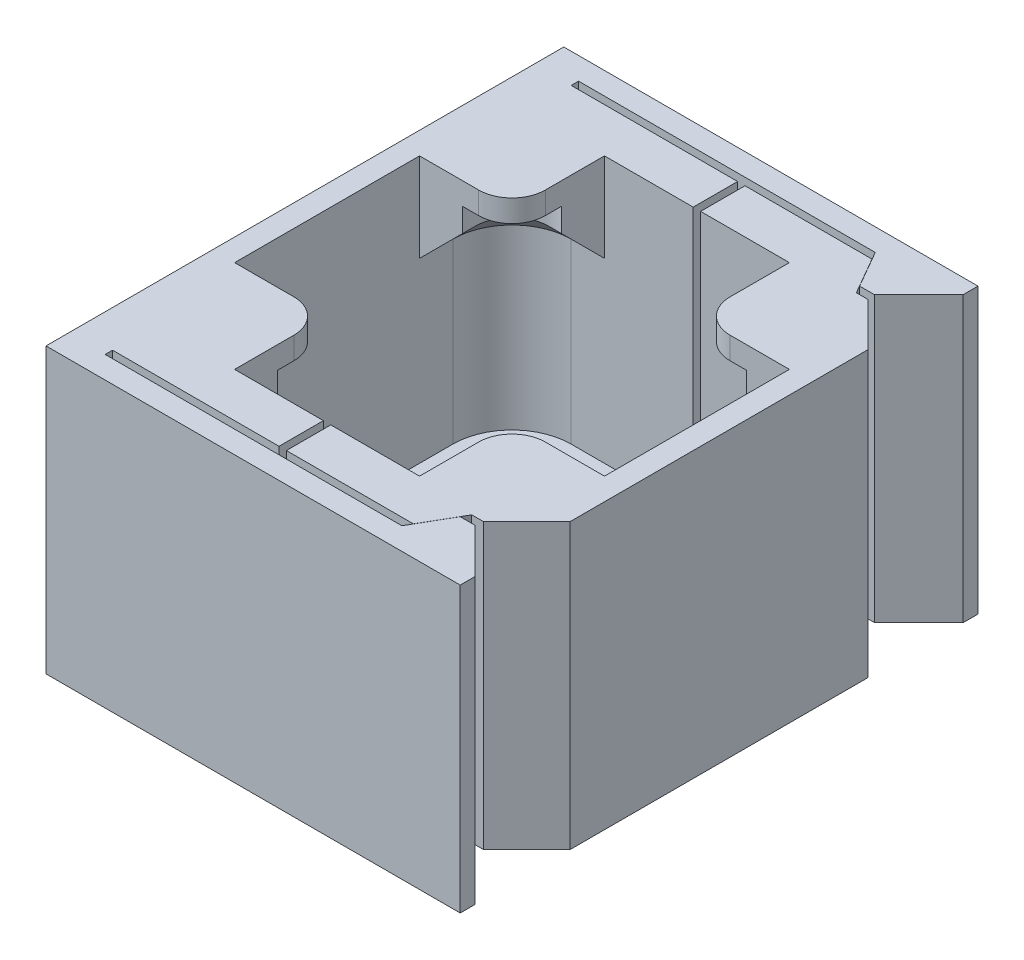
from build123d import *

# Parameters (mm, degrees)
SKETCH1_W           = 8.4
SKETCH1_H           = 3
SKETCH2_OUTSIDE_W   = 44.372
SKETCH2_OUTSIDE_H   = 44.372
SKETCH2_OUTSIDE_W_2 = 28
SKETCH2_OUTSIDE_H_2 = 35
CUT_EXTRUDE2_DEPTH  = 24.70949177
SKETCH2_3_W         = 28
SKETCH2_3_H         = 35
SKETCH2_3_W_2       = 25
SKETCH2_3_H_2       = 25
BOSS_EXTRUDE1_DEPTH = 15
BOSS_EXTRUDE2_START = -4.2
BOSS_EXTRUDE2_DEPTH = 4.2
FILLET1_R           = 4
BOSS_EXTRUDE4_DEPTH = 3
SKETCH3_5_R         = 2.25
SKETCH3_5_R_2       = 1.45
BOSS_EXTRUDE6_DEPTH = 1.5
SKETCH3_R           = 1.45
BOSS_EXTRUDE3_DEPTH = 1.5
CIRPATTERN7_COUNT   = 4
CHAMFER1_SIZE       = 3
CUT_EXTRUDE6_START  = -3
CUT_EXTRUDE6_DEPTH  = 3
CUT_EXTRUDE5_START  = -19.2
CUT_EXTRUDE5_DEPTH  = 19.2


# Read off the part's stored shape, not the designer's step: Cut-Extrude5
with BuildPart() as part:
    # Sketch1 → Revolve2 (revolve)
    with BuildSketch(Plane.XY, mode=Mode.PRIVATE) as revolve2_sk:
        with Locations((-12.3, -25.5)):
            Rectangle(SKETCH1_W, SKETCH1_H)
        Polygon((-6.35, -27), (-8.1, -27), (-16.5, -27), (-16.5, -28.2), (-8.1, -28.2), (-6.35, -28.2), align=None)
    revolve(revolve2_sk.sketch.rotate(Axis((0, 21.737527327, 0), (0, -1, 0)), 270), axis=Axis((0, 21.737527327, 0), (0, -1, 0)))

    # Sketch2 outside → Cut-Extrude2 (cut, through all)
    with BuildSketch(Plane(origin=(0, -24, 0), x_dir=(1, 0, 0), z_dir=(0, 1, 0))):
        Rectangle(SKETCH2_OUTSIDE_W, SKETCH2_OUTSIDE_H)
        Rectangle(SKETCH2_OUTSIDE_W_2, SKETCH2_OUTSIDE_H_2, mode=Mode.SUBTRACT)
    extrude(amount=-CUT_EXTRUDE2_DEPTH, mode=Mode.SUBTRACT)

    # Sketch2<3> → Boss-Extrude1 (add)
    with BuildSketch(Plane(origin=(0, -24, 0), x_dir=(1, 0, 0), z_dir=(0, 1, 0))):
        Rectangle(SKETCH2_3_W, SKETCH2_3_H)
        Rectangle(SKETCH2_3_W_2, SKETCH2_3_H_2, mode=Mode.SUBTRACT)
    extrude(amount=BOSS_EXTRUDE1_DEPTH)

    # Sketch2<4> → Boss-Extrude2 (add)
    with BuildSketch(Plane(origin=(0, -24, 0), x_dir=(1, 0, 0), z_dir=(0, 1, 0)).offset(BOSS_EXTRUDE2_START)):
        with BuildLine():
            Line((-12.5, -12.5), (-10.770329614, -12.5))
            ThreePointArc((-10.770329614, -12.5), (-11.66726189, -11.66726189), (-12.5, -10.770329614))
            Line((-12.5, -10.770329614), (-12.5, -12.5))
        make_face()
        with BuildLine():
            Line((12.5, -10.770329614), (12.5, -12.5))
            Line((12.5, -12.5), (10.770329614, -12.5))
            ThreePointArc((10.770329614, -12.5), (0, -16.5), (-10.770329614, -12.5))
            Line((-10.770329614, -12.5), (-12.5, -12.5))
            Line((-12.5, -12.5), (-12.5, -10.770329614))
            ThreePointArc((-12.5, -10.770329614), (-13.289133528, -9.7800271), (-14, -8.732124598))
            Line((-14, -8.732124598), (-14, -17.5))
            Line((-14, -17.5), (14, -17.5))
            Line((14, -17.5), (14, -8.732124598))
            ThreePointArc((14, -8.732124598), (13.289133528, -9.7800271), (12.5, -10.770329614))
        make_face()
        with BuildLine():
            Line((10.770329614, -12.5), (12.5, -12.5))
            Line((12.5, -12.5), (12.5, -10.770329614))
            ThreePointArc((12.5, -10.770329614), (11.66726189, -11.66726189), (10.770329614, -12.5))
        make_face()
        with BuildLine():
            Line((12.5, 12.5), (12.5, 10.770329614))
            ThreePointArc((12.5, 10.770329614), (13.289133528, 9.7800271), (14, 8.732124598))
            Line((14, 8.732124598), (14, 17.5))
            Line((14, 17.5), (-14, 17.5))
            Line((-14, 17.5), (-14, 8.732124598))
            ThreePointArc((-14, 8.732124598), (-13.289133528, 9.7800271), (-12.5, 10.770329614))
            Line((-12.5, 10.770329614), (-12.5, 12.5))
            Line((-12.5, 12.5), (-10.770329614, 12.5))
            ThreePointArc((-10.770329614, 12.5), (0, 16.5), (10.770329614, 12.5))
            Line((10.770329614, 12.5), (12.5, 12.5))
        make_face()
        with BuildLine():
            ThreePointArc((10.770329614, 12.5), (11.66726189, 11.66726189), (12.5, 10.770329614))
            Line((12.5, 10.770329614), (12.5, 12.5))
            Line((12.5, 12.5), (10.770329614, 12.5))
        make_face()
        with BuildLine():
            Line((-12.5, 12.5), (-12.5, 10.770329614))
            ThreePointArc((-12.5, 10.770329614), (-11.66726189, 11.66726189), (-10.770329614, 12.5))
            Line((-10.770329614, 12.5), (-12.5, 12.5))
        make_face()
    extrude(amount=BOSS_EXTRUDE2_DEPTH)

    # Fillet1
    fillet1_edges = [part.edges().sort_by_distance(p)[0] for p in [
        (-12.5, -16.5, 12.5),
        (12.5, -16.5, 12.5),
        (12.5, -16.5, -12.5),
        (-12.5, -16.5, -12.5),
    ]]
    fillet(fillet1_edges, radius=FILLET1_R)

    # Sketch3<3> → Boss-Extrude4 (add)
    with BuildSketch(Plane(origin=(0, -9, 0), x_dir=(1, 0, 0), z_dir=(0, 1, 0))):
        with BuildLine():
            Line((-12.5, 12.5), (-12.5, 8.5))
            ThreePointArc((-12.5, 8.5), (-11.328427125, 11.328427125), (-8.5, 12.5))
            Line((-8.5, 12.5), (-12.5, 12.5))
        make_face()
        with BuildLine():
            Line((-12.5, 6.25), (-9.589724736, 6.25))
            ThreePointArc((-9.589724736, 6.25), (-10.267766953, 10.267766953), (-6.25, 9.589724736))
            Line((-6.25, 9.589724736), (-6.25, 12.5))
            Line((-6.25, 12.5), (-8.5, 12.5))
            ThreePointArc((-8.5, 12.5), (-11.328427125, 11.328427125), (-12.5, 8.5))
            Line((-12.5, 8.5), (-12.5, 6.25))
        make_face()
    boss_extrude4 = extrude(amount=-BOSS_EXTRUDE4_DEPTH)

    # Sketch3<5> → Boss-Extrude6 (add)
    # profile 1 of 2: a face of its own
    with BuildSketch(Plane(origin=(0, -9, 0), x_dir=(1, 0, 0), z_dir=(0, 1, 0))):
        with BuildLine():
            Line((-9.589724736, 6.25), (-8.5, 6.25))
            ThreePointArc((-8.5, 6.25), (-10.090990258, 10.090990258), (-6.25, 8.5))
            Line((-6.25, 8.5), (-6.25, 9.589724736))
            ThreePointArc((-6.25, 9.589724736), (-10.267766953, 10.267766953), (-9.589724736, 6.25))
        make_face()
    # profile 2 of 2: a face of its own
    with BuildSketch(Plane(origin=(0, -9, 0), x_dir=(1, 0, 0), z_dir=(0, 1, 0))):
        with Locations((-8.5, 8.5)):
            Circle(SKETCH3_5_R)
        with Locations(Location((-8.5, 8.5, 0), (0, 0, 270))):
            Circle(SKETCH3_5_R_2, mode=Mode.SUBTRACT)
    boss_extrude6 = extrude(amount=-BOSS_EXTRUDE6_DEPTH)

    # Sketch3 → Boss-Extrude3 (add)
    with BuildSketch(Plane(origin=(0, -9, 0), x_dir=(1, 0, 0), z_dir=(0, 1, 0))):
        with Locations((-8.5, 8.5)):
            Circle(SKETCH3_R)
    boss_extrude3 = extrude(amount=-BOSS_EXTRUDE3_DEPTH)

    # CirPattern7: Boss-Extrude4, Boss-Extrude6, Boss-Extrude3 ×4 about axis
    cirpattern7_axis = Axis((0, 0, 0), (0, 1, 0))
    add([boss_extrude4.rotate(cirpattern7_axis, i * 360 / CIRPATTERN7_COUNT) for i in range(1, CIRPATTERN7_COUNT)])
    add([boss_extrude6.rotate(cirpattern7_axis, i * 360 / CIRPATTERN7_COUNT) for i in range(1, CIRPATTERN7_COUNT)])
    add([boss_extrude3.rotate(cirpattern7_axis, i * 360 / CIRPATTERN7_COUNT) for i in range(1, CIRPATTERN7_COUNT)])

    # Chamfer1
    # the kernel refuses this chamfer: 3 mm, written as the material it adds along each edge
    with BuildSketch(Plane(origin=(-8.5, -12, -8.5), x_dir=(0, 0, -1), z_dir=(1, 0, 0))) as chamfer1_piece_1_section:
        Polygon((4, -CHAMFER1_SIZE), (4 - CHAMFER1_SIZE, 0), (4, 0), align=None)
    chamfer1_piece_1 = revolve(axis=Axis((-8.5, -12, -8.5), (0, 1, 0)), revolution_arc=90, mode=Mode.PRIVATE)
    chamfer1_piece_1 = chamfer1_piece_1 - Plane(origin=(-8.5, -13.21364555, -8.5), x_dir=(-0.4358898943541021, 0, 0.8999999999999833), z_dir=(0, 1, 0)) * Cylinder(2.5, 16, mode=Mode.PRIVATE)
    add(chamfer1_piece_1)
    with BuildSketch(Plane(origin=(-6.25, -12, -12.5), x_dir=(0, -0.9996219169112969, -0.02749587661058621), z_dir=(-1, 0, 0))) as chamfer1_piece_2_section:
        Polygon((CHAMFER1_SIZE * 0.999621916911, CHAMFER1_SIZE * 0.0274958766106), (-CHAMFER1_SIZE * 0.0274958766106, CHAMFER1_SIZE * 0.999621916911), (0, 0), align=None)
    chamfer1_piece_2 = extrude(amount=2.25, mode=Mode.PRIVATE)
    chamfer1_piece_2 = chamfer1_piece_2 - Plane(origin=(-8.5, -13.109465827, -8.5), x_dir=(-0.4358898943541021, 0, 0.8999999999999833), z_dir=(0, 1, 0)) * Cylinder(2.5, 17, mode=Mode.PRIVATE)
    add(chamfer1_piece_2)
    with BuildSketch(Plane(origin=(-12.5, -12, -8.5), x_dir=(-0.027495876610586206, -0.9996219169112968, 0), z_dir=(0, 0, 1))) as chamfer1_piece_3_section:
        Polygon((CHAMFER1_SIZE * 0.999621916911, CHAMFER1_SIZE * 0.0274958766106), (-CHAMFER1_SIZE * 0.0274958766106, CHAMFER1_SIZE * 0.999621916911), (0, 0), align=None)
    chamfer1_piece_3 = extrude(amount=2.25, mode=Mode.PRIVATE)
    chamfer1_piece_3 = chamfer1_piece_3 - Plane(origin=(-8.5, -13.109465904, -8.5), x_dir=(-0.4358898943541021, 0, 0.8999999999999833), z_dir=(0, 1, 0)) * Cylinder(2.5, 17, mode=Mode.PRIVATE)
    add(chamfer1_piece_3)
    with BuildSketch(Plane(origin=(-8.5, -12, 8.5), x_dir=(-1, 0, 0), z_dir=(0, 0, -1))) as chamfer1_piece_4_section:
        Polygon((4, -CHAMFER1_SIZE), (4 - CHAMFER1_SIZE, 0), (4, 0), align=None)
    chamfer1_piece_4 = revolve(axis=Axis((-8.5, -12, 8.5), (0, 1, 0)), revolution_arc=90, mode=Mode.PRIVATE)
    chamfer1_piece_4 = chamfer1_piece_4 - Plane(origin=(-8.5, -13.21364555, 8.5), x_dir=(0.8999999999999833, 0, 0.4358898943541022), z_dir=(0, 1, 0)) * Cylinder(2.5, 16, mode=Mode.PRIVATE)
    add(chamfer1_piece_4)
    with BuildSketch(Plane(origin=(-12.5, -12, 6.25), x_dir=(-0.027495876610578136, -0.9996219169112969, 0), z_dir=(0, 0, 1))) as chamfer1_piece_5_section:
        Polygon((CHAMFER1_SIZE * 0.999621916911, CHAMFER1_SIZE * 0.0274958766106), (-CHAMFER1_SIZE * 0.0274958766106, CHAMFER1_SIZE * 0.999621916911), (0, 0), align=None)
    chamfer1_piece_5 = extrude(amount=2.25, mode=Mode.PRIVATE)
    chamfer1_piece_5 = chamfer1_piece_5 - Plane(origin=(-8.5, -13.109465827, 8.5), x_dir=(0.8999999999999833, 0, 0.4358898943541022), z_dir=(0, 1, 0)) * Cylinder(2.5, 17, mode=Mode.PRIVATE)
    add(chamfer1_piece_5)
    with BuildSketch(Plane(origin=(-8.5, -12, 12.5), x_dir=(0, -0.9996219169112969, 0.02749587661058621), z_dir=(1, 0, 0))) as chamfer1_piece_6_section:
        Polygon((CHAMFER1_SIZE * 0.999621916911, CHAMFER1_SIZE * 0.0274958766106), (-CHAMFER1_SIZE * 0.0274958766106, CHAMFER1_SIZE * 0.999621916911), (0, 0), align=None)
    chamfer1_piece_6 = extrude(amount=2.25, mode=Mode.PRIVATE)
    chamfer1_piece_6 = chamfer1_piece_6 - Plane(origin=(-8.5, -13.109465224, 8.5), x_dir=(0.8999999999999833, 0, 0.4358898943541022), z_dir=(0, 1, 0)) * Cylinder(2.5, 17, mode=Mode.PRIVATE)
    add(chamfer1_piece_6)
    with BuildSketch(Plane(origin=(8.5, -12, 8.5), x_dir=(0, 0, 1), z_dir=(-1, 0, 0))) as chamfer1_piece_7_section:
        Polygon((4, -CHAMFER1_SIZE), (4 - CHAMFER1_SIZE, 0), (4, 0), align=None)
    chamfer1_piece_7 = revolve(axis=Axis((8.5, -12, 8.5), (0, 1, 0)), revolution_arc=90, mode=Mode.PRIVATE)
    chamfer1_piece_7 = chamfer1_piece_7 - Plane(origin=(8.5, -13.21364555, 8.5), x_dir=(0.4358898943541022, 0, -0.8999999999999833), z_dir=(0, 1, 0)) * Cylinder(2.5, 16, mode=Mode.PRIVATE)
    add(chamfer1_piece_7)
    with BuildSketch(Plane(origin=(6.25, -12, 12.5), x_dir=(0, -0.9996219169112969, 0.02749587661057756), z_dir=(1, 0, 0))) as chamfer1_piece_8_section:
        Polygon((CHAMFER1_SIZE * 0.999621916911, CHAMFER1_SIZE * 0.0274958766106), (-CHAMFER1_SIZE * 0.0274958766106, CHAMFER1_SIZE * 0.999621916911), (0, 0), align=None)
    chamfer1_piece_8 = extrude(amount=2.25, mode=Mode.PRIVATE)
    chamfer1_piece_8 = chamfer1_piece_8 - Plane(origin=(8.5, -13.109465827, 8.5), x_dir=(0.4358898943541022, 0, -0.8999999999999833), z_dir=(0, 1, 0)) * Cylinder(2.5, 17, mode=Mode.PRIVATE)
    add(chamfer1_piece_8)
    with BuildSketch(Plane(origin=(12.5, -12, 8.5), x_dir=(0.02749587661059426, -0.9996219169112965, 0), z_dir=(0, 0, -1))) as chamfer1_piece_9_section:
        Polygon((CHAMFER1_SIZE * 0.999621916911, CHAMFER1_SIZE * 0.0274958766106), (-CHAMFER1_SIZE * 0.0274958766106, CHAMFER1_SIZE * 0.999621916911), (0, 0), align=None)
    chamfer1_piece_9 = extrude(amount=2.25, mode=Mode.PRIVATE)
    chamfer1_piece_9 = chamfer1_piece_9 - Plane(origin=(8.5, -13.109465969, 8.5), x_dir=(0.4358898943541022, 0, -0.8999999999999833), z_dir=(0, 1, 0)) * Cylinder(2.5, 17, mode=Mode.PRIVATE)
    add(chamfer1_piece_9)
    with BuildSketch(Plane(origin=(8.5, -12, -8.5), x_dir=(1, 0, 0), z_dir=(0, 0, 1))) as chamfer1_piece_10_section:
        Polygon((4, -CHAMFER1_SIZE), (4 - CHAMFER1_SIZE, 0), (4, 0), align=None)
    chamfer1_piece_10 = revolve(axis=Axis((8.5, -12, -8.5), (0, 1, 0)), revolution_arc=90, mode=Mode.PRIVATE)
    chamfer1_piece_10 = chamfer1_piece_10 - Plane(origin=(8.5, -13.21364555, -8.5), x_dir=(-0.8999999999999831, 0, -0.4358898943541023), z_dir=(0, 1, 0)) * Cylinder(2.5, 16, mode=Mode.PRIVATE)
    add(chamfer1_piece_10)
    with BuildSketch(Plane(origin=(12.5, -12, -6.25), x_dir=(0.02749587661058506, -0.9996219169112969, 0), z_dir=(0, 0, -1))) as chamfer1_piece_11_section:
        Polygon((CHAMFER1_SIZE * 0.999621916911, CHAMFER1_SIZE * 0.0274958766106), (-CHAMFER1_SIZE * 0.0274958766106, CHAMFER1_SIZE * 0.999621916911), (0, 0), align=None)
    chamfer1_piece_11 = extrude(amount=2.25, mode=Mode.PRIVATE)
    chamfer1_piece_11 = chamfer1_piece_11 - Plane(origin=(8.5, -13.109465859, -8.5), x_dir=(-0.8999999999999831, 0, -0.4358898943541023), z_dir=(0, 1, 0)) * Cylinder(2.5, 17, mode=Mode.PRIVATE)
    add(chamfer1_piece_11)
    with BuildSketch(Plane(origin=(8.5, -12, -12.5), x_dir=(0, -0.9996219169112965, -0.027495876610595413), z_dir=(-1, 0, 0))) as chamfer1_piece_12_section:
        Polygon((CHAMFER1_SIZE * 0.999621916911, CHAMFER1_SIZE * 0.0274958766106), (-CHAMFER1_SIZE * 0.0274958766106, CHAMFER1_SIZE * 0.999621916911), (0, 0), align=None)
    chamfer1_piece_12 = extrude(amount=2.25, mode=Mode.PRIVATE)
    chamfer1_piece_12 = chamfer1_piece_12 - Plane(origin=(8.5, -13.109465904, -8.5), x_dir=(-0.8999999999999831, 0, -0.4358898943541023), z_dir=(0, 1, 0)) * Cylinder(2.5, 17, mode=Mode.PRIVATE)
    add(chamfer1_piece_12)

    # Sketch5 → Cut-Extrude6 (cut)
    with BuildSketch(Plane(origin=(0, -24, 0), x_dir=(1, 0, 0), z_dir=(0, 1, 0)).offset(CUT_EXTRUDE6_START)):
        with BuildLine():
            Line((8.5, 12.5), (-8.5, 12.5))
            ThreePointArc((-8.5, 12.5), (-11.328427125, 11.328427125), (-12.5, 8.5))
            Line((-12.5, 8.5), (-12.5, -8.5))
            ThreePointArc((-12.5, -8.5), (-11.328427125, -11.328427125), (-8.5, -12.5))
            Line((-8.5, -12.5), (8.5, -12.5))
            ThreePointArc((8.5, -12.5), (11.328427125, -11.328427125), (12.5, -8.5))
            Line((12.5, -8.5), (12.5, 8.5))
            ThreePointArc((12.5, 8.5), (11.328427125, 11.328427125), (8.5, 12.5))
        make_face()
    extrude(amount=CUT_EXTRUDE6_DEPTH, mode=Mode.SUBTRACT)

    # Cut-Extrude5 outline → Cut-Extrude5 (cut)
    with BuildSketch(Plane(origin=(0, -9, 0), x_dir=(1, 0, 0), z_dir=(0, 1, 0)).offset(CUT_EXTRUDE5_START)):
        with BuildLine():
            Line((10.277128129, 13), (11.071067812, 13))
            Line((11.071067812, 13), (14, 10.071067812))
            Line((14, 10.071067812), (14, 16.5))
            Line((14, 16.5), (11, 13.5))
            Line((11, 13.5), (10, 13.5))
            Line((10, 13.5), (8.556624327, 16))
            Line((8.556624327, 16), (-11.5, 16))
            Line((-11.5, 16), (-11.5, 15.5))
            Line((-11.5, 15.5), (-0.25, 15.5))
            Line((-0.25, 15.5), (-0.25, 6.345076832))
            ThreePointArc((-0.25, 6.345076832), (0, 6.35), (0.25, 6.345076832))
            Line((0.25, 6.345076832), (0.25, 15.5))
            Line((0.25, 15.5), (8.833752456, 15.5))
            Line((8.833752456, 15.5), (10.277128129, 13))
        make_face()
    cut_extrude5 = extrude(amount=CUT_EXTRUDE5_DEPTH, mode=Mode.SUBTRACT)

    # Mirror1: Cut-Extrude5 across plane
    add(cut_extrude5.mirror(Plane.XY), mode=Mode.SUBTRACT)


solid = part.part
